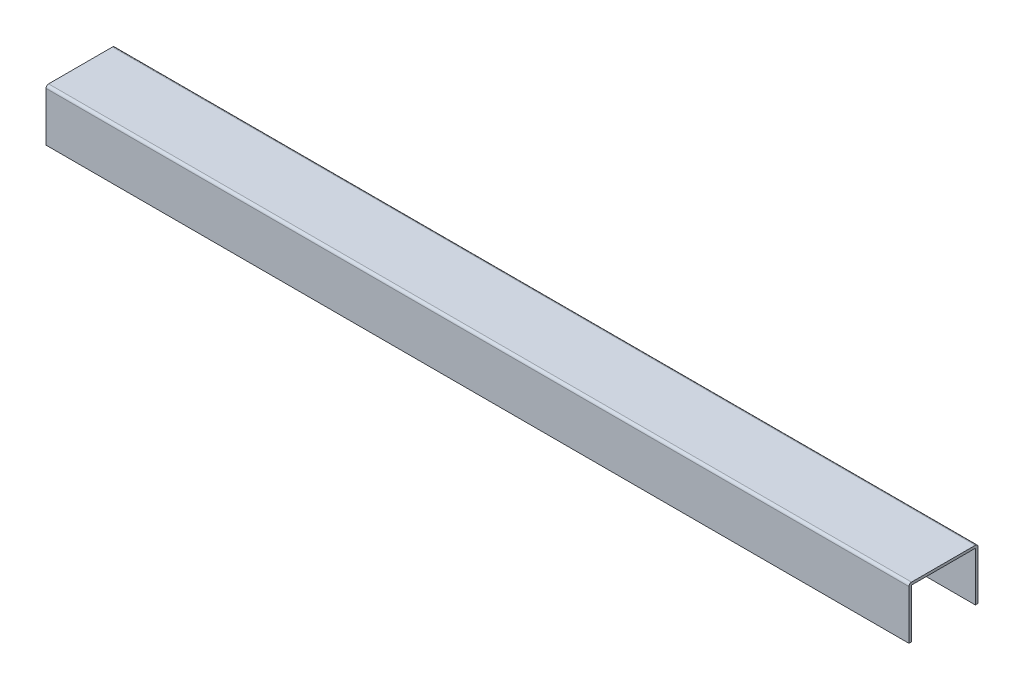
from build123d import *

# Parameters (mm, degrees)
SKETCH_1_W          = 74
SKETCH_1_H          = 74
EXTRUDE_1_DEPTH     = 1000
SKETCH_2_W          = 1000
SKETCH_2_H          = 20
CUT_EXTRUDE_1_DEPTH = 1007.379650033


with BuildPart() as part:
    # Эскиз1 → Вытянуть-Тонкостенный1 (new body)
    with BuildSketch(Plane(origin=(0, 0, 0), x_dir=(0, 0, -1), z_dir=(1, 0, 0))):
        with BuildLine():
            Line((0, 77), (0, 3))
            ThreePointArc((0, 3), (0.878679656, 0.878679656), (3, 0))
            Line((3, 0), (77, 0))
            ThreePointArc((77, 0), (79.121320344, 0.878679656), (80, 3))
            Line((80, 3), (80, 77))
            ThreePointArc((80, 77), (79.121320344, 79.121320344), (77, 80))
            Line((77, 80), (3, 80))
            ThreePointArc((3, 80), (0.878679656, 79.121320344), (0, 77))
        make_face()
        with Locations((40, 40)):
            Rectangle(SKETCH_1_W, SKETCH_1_H, mode=Mode.SUBTRACT)
    extrude(amount=EXTRUDE_1_DEPTH)

    # Эскиз2 → Вырез-Вытянуть1 (cut, through all)
    with BuildSketch(Plane(origin=(0, 0, -80), x_dir=(-1, 0, 0), z_dir=(0, 0, -1))):
        with Locations((-500, 10)):
            Rectangle(SKETCH_2_W, SKETCH_2_H)
    extrude(amount=-CUT_EXTRUDE_1_DEPTH, mode=Mode.SUBTRACT)


solid = part.part
